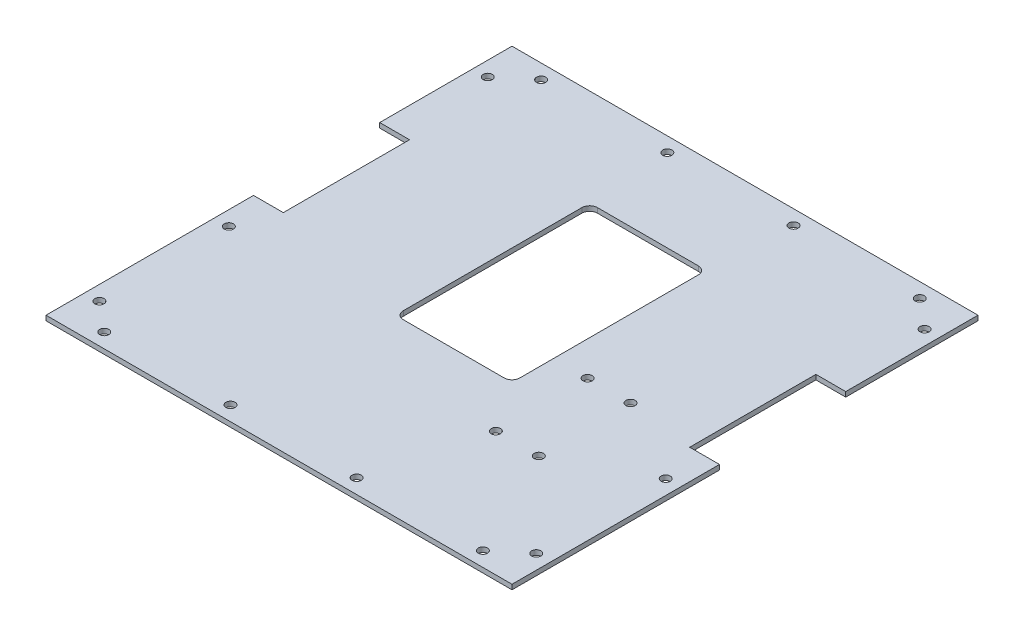
from build123d import *

# Parameters (mm, degrees)
SKETCH2_W             = 152.4
SKETCH2_H             = 152.4
BOSS_EXTRUDE1_DEPTH   = 1.5875
F_3_0MM_DOWEL_HOLE1_D = 3
F_3_0MM_DOWEL_HOLE2_D = 3
LPATTERN1_COUNT       = 4
LPATTERN1_PITCH       = 42.333333333
LPATTERN2_COUNT       = 4
LPATTERN2_PITCH       = 41.275
SKETCH12_W            = 38.1
SKETCH12_H            = 63.5
CUT_EXTRUDE1_DEPTH    = 2.54
FILLET2_R             = 2.54
SKETCH13_W            = 9.75
SKETCH13_H            = 41.28
CUT_EXTRUDE2_DEPTH    = 216.531993347
SKETCH14_R            = 1.5
CUT_EXTRUDE3_DEPTH    = 10


with BuildPart() as part:
    # Sketch2 → Boss-Extrude1 (new body)
    with BuildSketch(Plane(origin=(0, 0, 0), x_dir=(1, 0, 0), z_dir=(0, 1, 0))):
        with Locations((76.2, 76.2)):
            Rectangle(SKETCH2_W, SKETCH2_H)
    extrude(amount=BOSS_EXTRUDE1_DEPTH)

    # Ø3.0mm Dowel Hole1 (through all)
    with Locations(Plane(origin=(0, 1.5875, 0), x_dir=(1, 0, 0), z_dir=(0, 1, 0))):
        with Locations((14.2875, 147.6375), (14.2875, 4.7625)):
            f_3_0mm_dowel_hole1 = Hole(F_3_0MM_DOWEL_HOLE1_D / 2)

    # Ø3.0mm Dowel Hole2 (through all)
    with Locations(Plane(origin=(0, 1.5875, 0), x_dir=(1, 0, 0), z_dir=(0, 1, 0))):
        with Locations((4.7625, 139.7), (147.6375, 139.7)):
            f_3_0mm_dowel_hole2 = Hole(F_3_0MM_DOWEL_HOLE2_D / 2)

    # LPattern1: Ø3.0mm Dowel Hole2 ×4, 1 skipped
    with Locations(*[(0, 0, i * LPATTERN1_PITCH) for i in range(1, LPATTERN1_COUNT) if i not in (1,)]):
        add(f_3_0mm_dowel_hole2, mode=Mode.SUBTRACT)

    # LPattern2: Ø3.0mm Dowel Hole1 ×4
    with Locations(*[(i * LPATTERN2_PITCH, 0, 0) for i in range(1, LPATTERN2_COUNT)]):
        add(f_3_0mm_dowel_hole1, mode=Mode.SUBTRACT)

    # Sketch12 → Cut-Extrude1 (cut)
    with BuildSketch(Plane(origin=(0, 1.5875, 0), x_dir=(1, 0, 0), z_dir=(0, 1, 0))):
        with Locations((76.2, 88.9)):
            Rectangle(SKETCH12_W, SKETCH12_H)
    extrude(amount=-CUT_EXTRUDE1_DEPTH, mode=Mode.SUBTRACT)

    # Fillet2
    fillet2_edges = [part.edges().sort_by_distance(p)[0] for p in [
        (95.25, 0.79375, -57.15),
        (57.15, 0.79375, -57.15),
        (57.15, 0.79375, -120.65),
        (95.25, 0.79375, -120.65),
    ]]
    fillet(fillet2_edges, radius=FILLET2_R)

    # Sketch13 → Cut-Extrude2 (cut, through all)
    with BuildSketch(Plane(origin=(0, 1.5875, 0), x_dir=(1, 0, 0), z_dir=(0, 1, 0))):
        with Locations((147.525, 88.5)):
            Rectangle(SKETCH13_W, SKETCH13_H)
        with Locations((4.875, 88.5)):
            Rectangle(SKETCH13_W, SKETCH13_H)
    extrude(amount=-CUT_EXTRUDE2_DEPTH, mode=Mode.SUBTRACT)

    # Sketch14 → Cut-Extrude3 (cut)
    with BuildSketch(Plane.XZ):
        with Locations((120.450623047, -70.719396702)):
            Circle(SKETCH14_R)
        with Locations((106.400623047, -70.719396702)):
            Circle(SKETCH14_R)
        with Locations((120.450623047, -40.719396702)):
            Circle(SKETCH14_R)
        with Locations((106.400623047, -40.719396702)):
            Circle(SKETCH14_R)
    extrude(amount=-CUT_EXTRUDE3_DEPTH, mode=Mode.SUBTRACT)


solid = part.part
